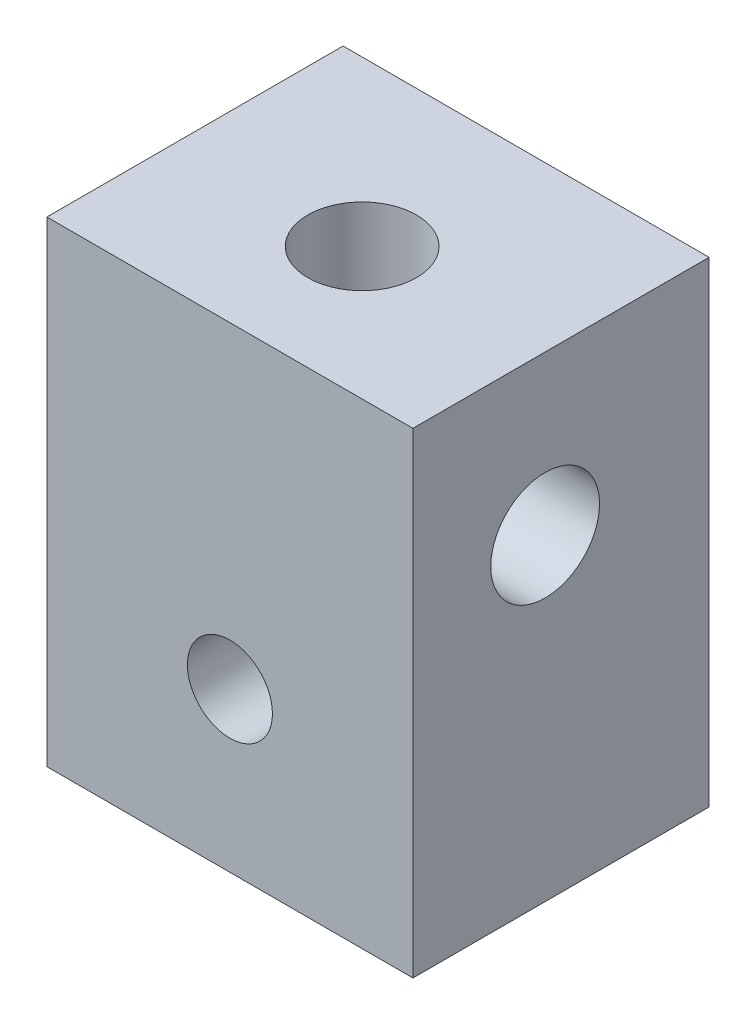
from build123d import *

# Parameters (mm, degrees)
SKETCH1_W                        = 21.971
SKETCH1_H                        = 17.78
BOSS_EXTRUDE1_DEPTH              = 28.575
F_10_CLEARANCE_HOLE1_D           = 5.1054
F_0_257_DIAMETER_HOLE1_D         = 6.5278
F_0_257_DIAMETER_HOLE2_OUTLINE_W = 3.2639
F_0_257_DIAMETER_HOLE2_OUTLINE_H = 9.525


# Read off the part's stored shape, not the designer's step: F (0.257) Diameter Hole2
with BuildPart() as part:
    # Sketch1 → Boss-Extrude1 (new body)
    with BuildSketch(Plane(origin=(0, 0, 0), x_dir=(1, 0, 0), z_dir=(0, 1, 0))):
        with Locations((10.9855, 8.89)):
            Rectangle(SKETCH1_W, SKETCH1_H)
    extrude(amount=-BOSS_EXTRUDE1_DEPTH)

    # #10 Clearance Hole1 (through all)
    with Locations(Plane.XY):
        with Locations((10.9855, -19.05)):
            Hole(F_10_CLEARANCE_HOLE1_D / 2)

    # F (0.257) Diameter Hole1 (through all)
    with Locations(Plane.ZY):
        with Locations((-7.9375, -9.525)):
            Hole(F_0_257_DIAMETER_HOLE1_D / 2)

    # F (0.257) Diameter Hole2 outline → F (0.257) Diameter Hole2 (revolve, cut)
    with BuildSketch(Plane(origin=(10.9855, 0, -7.9375), x_dir=(1, 0, 0), z_dir=(0, 0, 1))):
        with Locations((1.63195, -4.7625)):
            Rectangle(F_0_257_DIAMETER_HOLE2_OUTLINE_W, F_0_257_DIAMETER_HOLE2_OUTLINE_H)
    revolve(axis=Axis((10.9855, 0, -7.9375), (0, 1, 0)), mode=Mode.SUBTRACT)


solid = part.part
